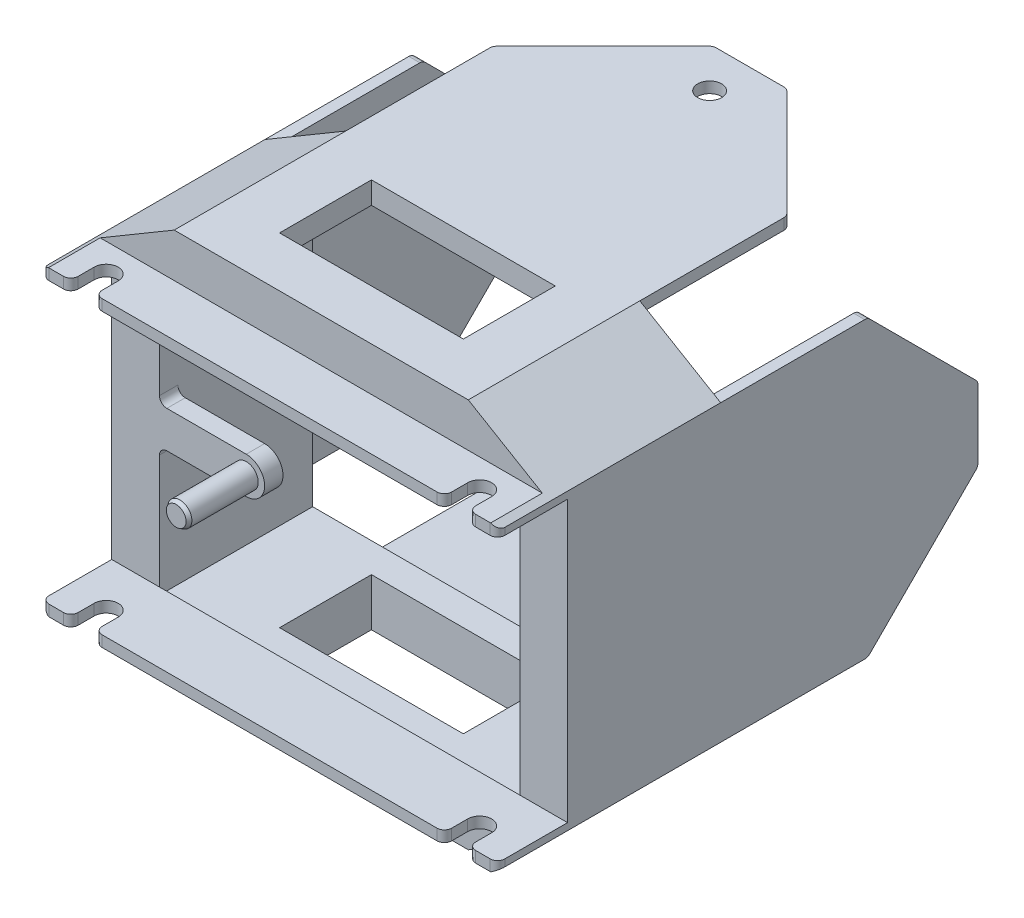
from build123d import *

# Parameters (mm, degrees)
SKETCH1_W           = 10
SKETCH1_H           = 80
SKETCH1_W_2         = 3
SKETCH1_W_3         = 80
SKETCH1_H_2         = 3
SKETCH1_H_3         = 10
SKETCH1_W_4         = 30
BOSS_EXTRUDE1_DEPTH = 41.657
SKETCH1_6_W         = 3
SKETCH1_6_H         = 80
SKETCH1_6_W_2       = 80
SKETCH1_6_H_2       = 3
SKETCH1_6_W_3       = 50
BOSS_EXTRUDE2_DEPTH = 70
CUT_EXTRUDE1_REACH  = 170.841
SKETCH2_R           = 3.2639
CUT_EXTRUDE2_REACH  = 145.243
SKETCH3_R           = 3.2639
SKETCH4_W           = 98
SKETCH4_H           = 1.9
BOSS_EXTRUDE3_DEPTH = 5
SKETCH4_4_W         = 98
SKETCH4_4_H         = 1.9
BOSS_EXTRUDE4_DEPTH = 19.05
CUT_EXTRUDE3_DEPTH  = 135.675178822
SKETCH6_R           = 3.2639
BOSS_EXTRUDE5_DEPTH = 5
SKETCH6_3_R         = 3.2639
BOSS_EXTRUDE6_DEPTH = 19.05
SKETCH7_W           = 50
SKETCH7_H           = 25
CUT_EXTRUDE4_DEPTH  = 144.24312825
CHAMFER1_SIZE       = 30
CHAMFER2_SIZE       = 1
CHAMFER2_SIZE2      = 0.577350269
FILLET1_R           = 2


with BuildPart() as part:
    # Sketch1 → Boss-Extrude1 (new body)
    with BuildSketch(Plane.XY):
        with Locations((-49.798838448, 37.726897406)):
            Rectangle(SKETCH1_W, SKETCH1_H)
        with Locations((-56.298838448, 37.726897406)):
            Rectangle(SKETCH1_W_2, SKETCH1_H)
        Polygon((-35.798838448, 87.726897406), (-35.798838448, 84.726897406), (-44.798838448, 77.726897406), (-54.798838448, 77.726897406), (-57.798838448, 77.726897406), (-35.798838448, 90.726897406), align=None)
        with Locations((4.201161552, 86.226897406)):
            Rectangle(SKETCH1_W_3, SKETCH1_H_2)
        with Locations((4.201161552, 89.226897406)):
            Rectangle(SKETCH1_W_3, SKETCH1_H_2)
        Polygon((44.201161552, 87.726897406), (44.201161552, 90.726897406), (66.201161552, 77.726897406), (63.201161552, 77.726897406), (53.201161552, 77.726897406), (44.201161552, 84.726897406), align=None)
        with Locations((58.201161552, 37.726897406)):
            Rectangle(SKETCH1_W, SKETCH1_H)
        with Locations((64.701161552, 37.726897406)):
            Rectangle(SKETCH1_W_2, SKETCH1_H)
        with Locations((4.201161552, -7.273102594)):
            Rectangle(SKETCH1_W_3, SKETCH1_H_3)
        Polygon((66.201161552, -2.273102594), (44.201161552, -15.273102594), (44.201161552, -12.273102594), (44.201161552, -2.273102594), (53.201161552, -2.273102594), (63.201161552, -2.273102594), align=None)
        Polygon((-35.798838448, -15.273102594), (-57.798838448, -2.273102594), (-54.798838448, -2.273102594), (-44.798838448, -2.273102594), (-35.798838448, -2.273102594), (-35.798838448, -12.273102594), align=None)
        with Locations((4.201161552, -13.773102594)):
            Rectangle(SKETCH1_W_3, SKETCH1_H_2)
        with Locations((29.201161552, -13.773102594)):
            Rectangle(SKETCH1_W_4, SKETCH1_H_2)
    extrude(amount=BOSS_EXTRUDE1_DEPTH)

    # Sketch1<6> → Boss-Extrude2 (add)
    with BuildSketch(Plane.XY):
        with Locations((-56.298838448, 37.726897406)):
            Rectangle(SKETCH1_6_W, SKETCH1_6_H)
        with Locations((4.201161552, 89.226897406)):
            Rectangle(SKETCH1_6_W_2, SKETCH1_6_H_2)
        with Locations((-10.798838448, -13.773102594)):
            Rectangle(SKETCH1_6_W_3, SKETCH1_6_H_2)
        with Locations((64.701161552, 37.726897406)):
            Rectangle(SKETCH1_6_W, SKETCH1_6_H)
    extrude(amount=-BOSS_EXTRUDE2_DEPTH)

    # Sketch2 → Cut-Extrude1 (cut, up to next)
    with BuildSketch(Plane.ZY.offset(57.798838448), mode=Mode.PRIVATE) as cut_extrude1_sk1:
        with Locations(Location((-59, 37.726897406, 0), (0, 0, 270))):
            Circle(SKETCH2_R)
    cut_extrude1_tool1 = extrude(cut_extrude1_sk1.sketch, amount=-CUT_EXTRUDE1_REACH, mode=Mode.PRIVATE) & part.part
    add(cut_extrude1_tool1.solids().sort_by_distance((-57.798838, 37.726897, -59))[0], mode=Mode.SUBTRACT)

    # Sketch3 → Cut-Extrude2 (cut, up to next)
    with BuildSketch(Plane(origin=(0, 90.726897406, 0), x_dir=(1, 0, 0), z_dir=(0, 1, 0)), mode=Mode.PRIVATE) as cut_extrude2_sk1:
        with Locations(Location((4.201161552, 59, 0), (0, 0, 270))):
            Circle(SKETCH3_R)
    cut_extrude2_tool1 = extrude(cut_extrude2_sk1.sketch, amount=-CUT_EXTRUDE2_REACH, mode=Mode.PRIVATE) & part.part
    add(cut_extrude2_tool1.solids().sort_by_distance((4.201162, 90.726897, -59))[0], mode=Mode.SUBTRACT)

    # Sketch4 → Boss-Extrude3 (add)
    with BuildSketch(Plane.XY.offset(41.657)):
        Polygon((51.786875838, 78.826897406), (64.33962309, 78.826897406), (44.201161552, 90.726897406), (-35.798838448, 90.726897406), (-55.937299987, 78.826897406), (-43.384552734, 78.826897406), (-35.798838448, 84.726897406), (44.201161552, 84.726897406), align=None)
        Polygon((-43.384552734, 78.826897406), (51.786875838, 78.826897406), (44.201161552, 84.726897406), (-35.798838448, 84.726897406), align=None)
        Polygon((53.201161552, 75.826897406), (66.201161552, 75.826897406), (66.201161552, 77.726897406), (64.33962309, 78.826897406), (51.786875838, 78.826897406), (53.201161552, 77.726897406), align=None)
        Polygon((-44.798838448, 75.826897406), (53.201161552, 75.826897406), (53.201161552, 77.726897406), (51.786875838, 78.826897406), (-43.384552734, 78.826897406), (-44.798838448, 77.726897406), align=None)
        Polygon((66.201161552, -2.273102594), (66.201161552, -0.373102594), (53.201161552, -0.373102594), (53.201161552, -2.273102594), (-44.798838448, -2.273102594), (-44.798838448, -0.373102594), (-57.798838448, -0.373102594), (-57.798838448, -2.273102594), (-55.937299987, -3.373102594), (64.33962309, -3.373102594), align=None)
        with Locations((4.201161552, -1.323102594)):
            Rectangle(SKETCH4_W, SKETCH4_H)
        Polygon((44.201161552, -15.273102594), (64.33962309, -3.373102594), (-55.937299987, -3.373102594), (-35.798838448, -15.273102594), align=None)
        Polygon((-57.798838448, 75.826897406), (-44.798838448, 75.826897406), (-44.798838448, 77.726897406), (-43.384552734, 78.826897406), (-55.937299987, 78.826897406), (-57.798838448, 77.726897406), align=None)
    extrude(amount=BOSS_EXTRUDE3_DEPTH)

    # Sketch4<4> → Boss-Extrude4 (add)
    with BuildSketch(Plane.XY.offset(41.657)):
        Polygon((53.201161552, 75.826897406), (66.201161552, 75.826897406), (66.201161552, 77.726897406), (64.33962309, 78.826897406), (51.786875838, 78.826897406), (53.201161552, 77.726897406), align=None)
        Polygon((-44.798838448, 75.826897406), (53.201161552, 75.826897406), (53.201161552, 77.726897406), (51.786875838, 78.826897406), (-43.384552734, 78.826897406), (-44.798838448, 77.726897406), align=None)
        Polygon((66.201161552, -2.273102594), (66.201161552, -0.373102594), (53.201161552, -0.373102594), (53.201161552, -2.273102594), (-44.798838448, -2.273102594), (-44.798838448, -0.373102594), (-57.798838448, -0.373102594), (-57.798838448, -2.273102594), (-55.937299987, -3.373102594), (64.33962309, -3.373102594), align=None)
        with Locations((4.201161552, -1.323102594)):
            Rectangle(SKETCH4_4_W, SKETCH4_4_H)
        Polygon((-57.798838448, 75.826897406), (-44.798838448, 75.826897406), (-44.798838448, 77.726897406), (-43.384552734, 78.826897406), (-55.937299987, 78.826897406), (-57.798838448, 77.726897406), align=None)
    extrude(amount=BOSS_EXTRUDE4_DEPTH)

    # Sketch5 → Cut-Extrude3 (cut, through all)
    with BuildSketch(Plane.XZ.offset(3.373102594)):
        with BuildLine():
            Line((-49.862738448, 60.707), (-49.862738448, 54.357))
            ThreePointArc((-49.862738448, 54.357), (-46.598838448, 51.0931), (-43.334938448, 54.357))
            Line((-43.334938448, 54.357), (-43.334938448, 60.707))
            Line((-43.334938448, 60.707), (-49.862738448, 60.707))
        make_face()
        with BuildLine():
            Line((51.737261552, 60.707), (51.737261552, 54.357))
            ThreePointArc((51.737261552, 54.357), (55.001161552, 51.0931), (58.265061552, 54.357))
            Line((58.265061552, 54.357), (58.265061552, 60.707))
            Line((58.265061552, 60.707), (51.737261552, 60.707))
        make_face()
    extrude(amount=-CUT_EXTRUDE3_DEPTH, mode=Mode.SUBTRACT)

    # Sketch6 → Boss-Extrude5 (add)
    # profile 1 of 2: a face of its own
    with BuildSketch(Plane.XY.offset(41.657)):
        with BuildLine():
            Line((-44.798838448, 42.726897406), (-44.798838448, 37.726897406))
            Line((-44.798838448, 37.726897406), (-44.798838448, 32.726897406))
            Line((-44.798838448, 32.726897406), (-21.198838448, 32.726897406))
            ThreePointArc((-21.198838448, 32.726897406), (-16.198838448, 37.726897406), (-21.198838448, 42.726897406))
            Line((-21.198838448, 42.726897406), (-44.798838448, 42.726897406))
        make_face()
        with Locations((-21.198838448, 37.726897406)):
            Circle(SKETCH6_R, mode=Mode.SUBTRACT)
    # profile 2 of 2: a face of its own
    with BuildSketch(Plane.XY.offset(41.657)):
        with Locations((-21.198838448, 37.726897406)):
            Circle(SKETCH6_R)
    extrude(amount=-BOSS_EXTRUDE5_DEPTH)

    # Sketch6<3> → Boss-Extrude6 (add)
    with BuildSketch(Plane.XY.offset(41.657)):
        with Locations(Location((-21.198838448, 37.726897406, 0), (0, 0, 180))):
            Circle(SKETCH6_3_R)
    extrude(amount=BOSS_EXTRUDE6_DEPTH)

    # Sketch7 → Cut-Extrude4 (cut, through all)
    with BuildSketch(Plane(origin=(0, 90.726897406, 0), x_dir=(1, 0, 0), z_dir=(0, 1, 0))):
        with Locations((4.201161552, -20.5)):
            Rectangle(SKETCH7_W, SKETCH7_H)
    extrude(amount=-CUT_EXTRUDE4_DEPTH, mode=Mode.SUBTRACT)

    # Chamfer1
    # the kernel refuses this chamfer: 30 mm, written as the material it takes off along each edge
    with BuildSketch(Plane(origin=(22.351651191, 77.726897406, -70), x_dir=(0, 0.02749587661058632, 0.9996219169112968), z_dir=(-1, 0, 0)), Plane(origin=(-134.949328087, -2.273102594, -70), x_dir=(0, -0.02749587661058638, 0.9996219169112968), z_dir=(1, 0, 0)), Plane(origin=(-35.798838448, 64.877387045, -70), x_dir=(-0.02749587661058632, 0, 0.9996219169112968), z_dir=(0, -1, 0)), Plane(origin=(14.201161552, -92.423592233, -70), x_dir=(0.02749587661058638, 0, 0.9996219169112968), z_dir=(0, 1, 0)), Plane(origin=(-13.949328087, -2.273102594, -70), x_dir=(0, -0.02749587661058636, 0.9996219169112968), z_dir=(1, 0, 0)), Plane(origin=(143.351651191, 77.726897406, -70), x_dir=(0, 0.02749587661058632, 0.9996219169112968), z_dir=(-1, 0, 0)), Plane(origin=(44.201161552, 10.576407767, -70), x_dir=(0.02749587661058632, 0, 0.9996219169112968), z_dir=(0, 1, 0)), Plane(origin=(-35.798838448, 167.877387045, -70), x_dir=(-0.02749587661058632, 0, 0.9996219169112968), z_dir=(0, -1, 0))) as chamfer1_piece_1:
        Polygon((CHAMFER1_SIZE * 0.999621916911, -CHAMFER1_SIZE * 0.0274958766106), (-CHAMFER1_SIZE * 0.0274958766106, -CHAMFER1_SIZE * 0.999621916911), (0, 0), align=None)
    extrude(amount=157.300979278, mode=Mode.SUBTRACT)

    # Chamfer2
    chamfer2_edges = [part.edges().sort_by_distance(p)[0] for p in [
        (-17.934938448, 37.726897406, 60.707),
    ]]
    chamfer2_side = [part.faces().sort_by_distance(p)[0] for p in [
        (-17.934938448, 37.726897406, 51.182),
    ]]
    chamfer(chamfer2_edges, length=CHAMFER2_SIZE, length2=CHAMFER2_SIZE2, reference=chamfer2_side[0])

    # Fillet1
    fillet1_edges = [part.edges().sort_by_distance(p)[0] for p in [
        (66.201161552, -1.323102594, 60.707),
        (-57.798838448, -1.323102594, 60.707),
        (-57.798838448, 76.776897406, 60.707),
        (66.201161552, 76.776897406, 60.707),
        (58.265061552, 77.326897406, 60.707),
        (51.737261552, 77.326897406, 60.707),
        (-43.334938448, 77.326897406, 60.707),
        (-49.862738448, 77.326897406, 60.707),
        (-49.862738448, -1.873102594, 60.707),
        (-43.334938448, -1.873102594, 60.707),
        (51.737261552, -1.873102594, 60.707),
        (58.265061552, -1.873102594, 60.707),
        (-44.798838448, 32.726897406, 39.157),
        (-44.798838448, 42.726897406, 39.157),
        (14.201161552, 89.226897406, -70),
        (-5.798838448, 89.226897406, -70),
        (-35.798838448, 89.226897406, -40),
        (-56.298838448, 77.726897406, -40),
        (-56.298838448, 27.726897406, -70),
        (-56.298838448, 47.726897406, -70),
        (-56.298838448, -2.273102594, -40),
        (-35.798838448, -13.773102594, -40),
        (14.201161552, -13.773102594, -40),
        (64.701161552, -2.273102594, -40),
        (64.701161552, 47.726897406, -70),
        (64.701161552, 27.726897406, -70),
        (64.701161552, 77.726897406, -40),
        (44.201161552, 89.226897406, -40),
        (-10.798838448, -13.773102594, -65),
    ]]
    fillet(fillet1_edges, radius=FILLET1_R)


solid = part.part
